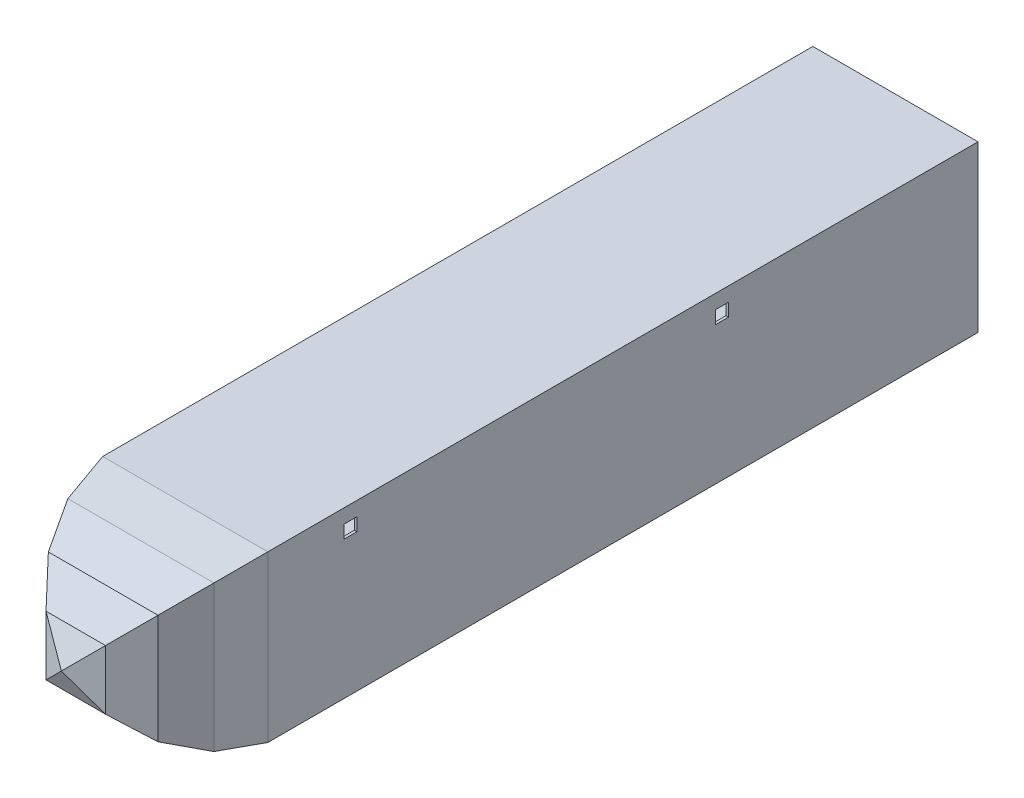
from build123d import *

# Parameters (mm, degrees)
SKETCH1_W           = 101.6
SKETCH1_H           = 101.6
BOSS_EXTRUDE1_DEPTH = 436.88
SHELL1_T            = -1.5875
SKETCH9_W           = 8.001
SKETCH9_H           = 8.001
CUT_EXTRUDE1_DEPTH  = 526.503840631


with BuildPart() as part:
    # Sketch1 → Boss-Extrude1 (new body)
    with BuildSketch(Plane.XY):
        Rectangle(SKETCH1_W, SKETCH1_H)
    extrude(amount=BOSS_EXTRUDE1_DEPTH)

    # Sketch5 → Loft2 section 0
    with BuildSketch(Plane.XY.offset(436.88)):
        with BuildLine():
            Line((50.8, -50.8), (50.8, 50.8))
            Line((50.8, 50.8), (-50.8, 50.8))
            Line((-50.8, 50.8), (-50.8, -50.8))
            Line((-50.8, -50.8), (50.8, -50.8))
        make_face()
    # Sketch3 → Loft2 section 1
    with BuildSketch(Plane.XY.offset(464.156588322)):
        with BuildLine():
            Line((-44.913226277, -44.913226277), (44.913226277, -44.913226277))
            Line((44.913226277, -44.913226277), (44.913226277, 44.913226277))
            Line((44.913226277, 44.913226277), (-44.913226277, 44.913226277))
            Line((-44.913226277, 44.913226277), (-44.913226277, -44.913226277))
        make_face()
    loft()

    # Sketch3<6> → Loft3 section 0
    with BuildSketch(Plane.XY.offset(464.156588322)):
        with BuildLine():
            Line((-44.913226277, -44.913226277), (44.913226277, -44.913226277))
            Line((44.913226277, -44.913226277), (44.913226277, 44.913226277))
            Line((44.913226277, 44.913226277), (-44.913226277, 44.913226277))
            Line((-44.913226277, 44.913226277), (-44.913226277, -44.913226277))
        make_face()
    # Sketch6 → Loft3 section 1
    with BuildSketch(Plane.XY.offset(487.359440316)):
        with BuildLine():
            Line((-33.715917201, -33.715917221), (33.715917201, -33.715917221))
            Line((33.715917201, -33.715917221), (33.715917201, 33.715917221))
            Line((33.715917201, 33.715917221), (-33.715917201, 33.715917221))
            Line((-33.715917201, 33.715917221), (-33.715917201, -33.715917221))
        make_face()
    loft()

    # Sketch6<4> → Loft4 section 0
    with BuildSketch(Plane.XY.offset(487.359440316)):
        with BuildLine():
            Line((-33.715917201, -33.715917221), (33.715917201, -33.715917221))
            Line((33.715917201, -33.715917221), (33.715917201, 33.715917221))
            Line((33.715917201, 33.715917221), (-33.715917201, 33.715917221))
            Line((-33.715917201, 33.715917221), (-33.715917201, -33.715917221))
        make_face()
    # Sketch7 → Loft4 section 1
    with BuildSketch(Plane.XY.offset(504.217299158)):
        with BuildLine():
            Line((-18.304143478, -18.304143458), (18.304143478, -18.304143458))
            Line((18.304143478, -18.304143458), (18.304143478, 18.304143458))
            Line((18.304143478, 18.304143458), (-18.304143478, 18.304143458))
            Line((-18.304143478, 18.304143458), (-18.304143478, -18.304143458))
        make_face()
    loft()

    # Sketch7<5> → Loft5 section 0
    with BuildSketch(Plane.XY.offset(504.217299158), mode=Mode.PRIVATE) as loft5_s0:
        with BuildLine():
            Line((-18.304143478, -18.304143458), (18.304143478, -18.304143458))
            Line((18.304143478, -18.304143458), (18.304143478, 18.304143458))
            Line((18.304143478, 18.304143458), (-18.304143478, 18.304143458))
            Line((-18.304143478, 18.304143458), (-18.304143478, -18.304143458))
        make_face()
    loft([Vertex(0, 0, 513.079999985), loft5_s0.sketch])

    # Shell1
    shell1_openings = [part.faces().sort_by_distance(p)[0] for p in [
        (0, 0, 0),
    ]]
    offset(amount=SHELL1_T, openings=shell1_openings, kind=Kind.INTERSECTION)

    # Sketch9 → Cut-Extrude1 (cut, through all)
    with BuildSketch(Plane(origin=(50.8, 0, 0), x_dir=(0, 0, -1), z_dir=(1, 0, 0))):
        with Locations((-386.08, 38.1)):
            Rectangle(SKETCH9_W, SKETCH9_H)
        Polygon((-161.4805, 42.1005), (-161.4805, 38.1), (-161.4805, 34.0995), (-153.4795, 34.0995), (-153.4795, 42.1005), align=None)
    extrude(amount=-CUT_EXTRUDE1_DEPTH, mode=Mode.SUBTRACT)


solid = part.part
